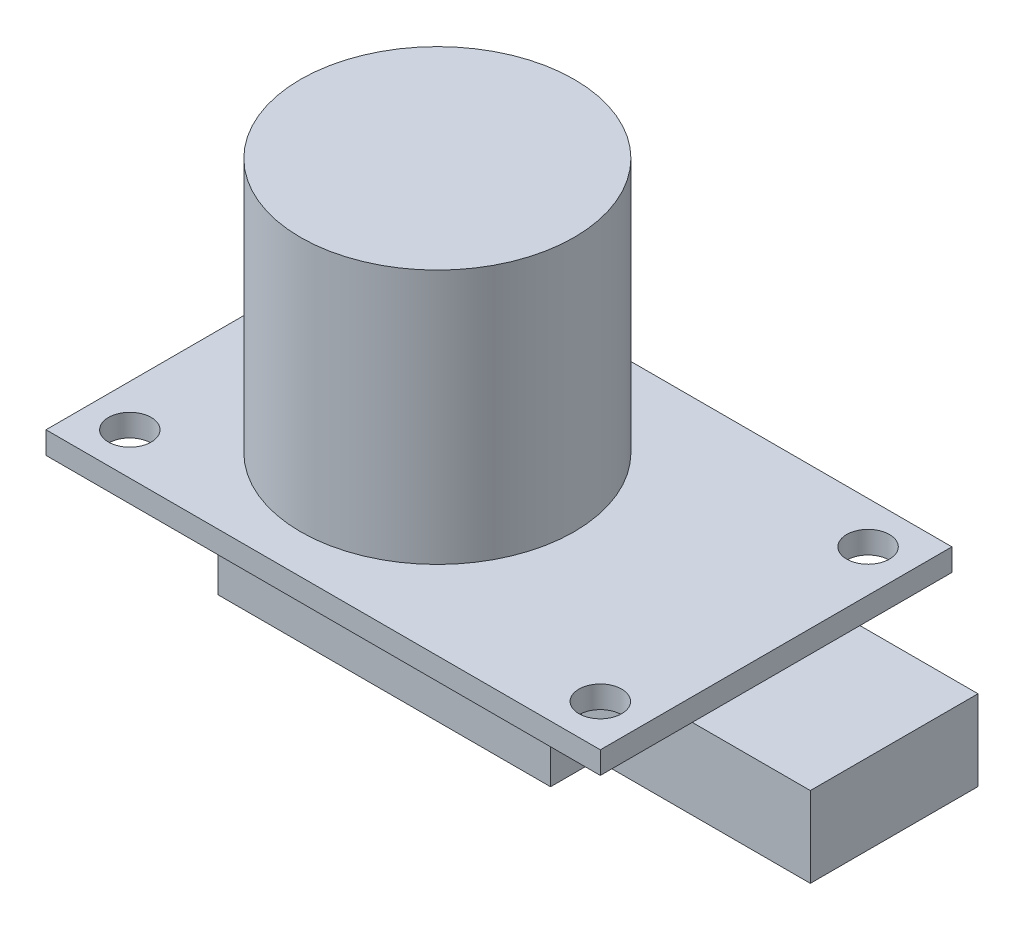
from build123d import *

# Parameters (mm, degrees)
SKETCH1_W           = 32.4
SKETCH1_H           = 20.55
SKETCH1_R           = 1.25
BOSS_EXTRUDE1_DEPTH = 1.3
SKETCH2_R           = 8
BOSS_EXTRUDE2_DEPTH = 14.9
SKETCH3_W           = 19.437089118
SKETCH3_H           = 13.404889048
BOSS_EXTRUDE3_DEPTH = 5.6
SKETCH4_W           = 13.8
SKETCH4_H           = 9.8
BOSS_EXTRUDE4_DEPTH = 4.7


with BuildPart() as part:
    # Sketch1 → Boss-Extrude1 (new body)
    with BuildSketch(Plane(origin=(0, 0, 0), x_dir=(1, 0, 0), z_dir=(0, 1, 0))):
        Rectangle(SKETCH1_W, SKETCH1_H)
        with Locations((-13.75, 7.825)):
            Circle(SKETCH1_R, mode=Mode.SUBTRACT)
        with Locations((-13.75, -7.825)):
            Circle(SKETCH1_R, mode=Mode.SUBTRACT)
        with Locations((13.75, -7.825)):
            Circle(SKETCH1_R, mode=Mode.SUBTRACT)
        with Locations((13.75, 7.825)):
            Circle(SKETCH1_R, mode=Mode.SUBTRACT)
    extrude(amount=BOSS_EXTRUDE1_DEPTH)

    # Sketch2 → Boss-Extrude2 (add)
    with BuildSketch(Plane(origin=(0, 1.3, 0), x_dir=(1, 0, 0), z_dir=(0, 1, 0))):
        with Locations((-3.6, 0)):
            Circle(SKETCH2_R)
    extrude(amount=BOSS_EXTRUDE2_DEPTH)

    # Sketch3 → Boss-Extrude3 (add)
    with BuildSketch(Plane.XZ):
        Rectangle(SKETCH3_W, SKETCH3_H)
    extrude(amount=BOSS_EXTRUDE3_DEPTH)

    # Sketch4 → Boss-Extrude4 (add)
    with BuildSketch(Plane.XZ):
        with Locations((16.2, 0)):
            Rectangle(SKETCH4_W, SKETCH4_H)
    extrude(amount=BOSS_EXTRUDE4_DEPTH)


solid = part.part
